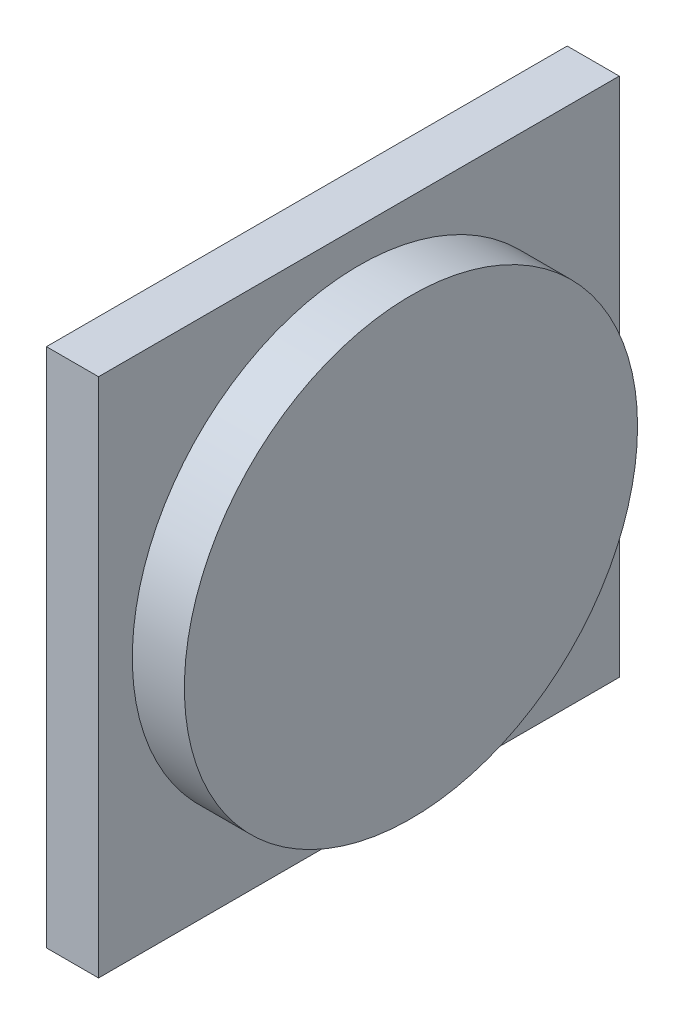
from build123d import *

# Parameters (mm, degrees)
SKETCH1_W           = 10
SKETCH1_H           = 10
BOSS_EXTRUDE1_DEPTH = 1
SKETCH2_R           = 4.351212525
BOSS_EXTRUDE2_DEPTH = 1


with BuildPart() as part:
    # Sketch1 → Boss-Extrude1 (new body)
    with BuildSketch(Plane(origin=(0, 0, 0), x_dir=(0, 0, -1), z_dir=(1, 0, 0))):
        with Locations((5, 5)):
            Rectangle(SKETCH1_W, SKETCH1_H)
    extrude(amount=BOSS_EXTRUDE1_DEPTH)

    # Sketch2 → Boss-Extrude2 (add)
    with BuildSketch(Plane(origin=(1, 0, 0), x_dir=(0, 0, -1), z_dir=(1, 0, 0))):
        with Locations((5, 5)):
            Circle(SKETCH2_R)
    extrude(amount=BOSS_EXTRUDE2_DEPTH)


solid = part.part
